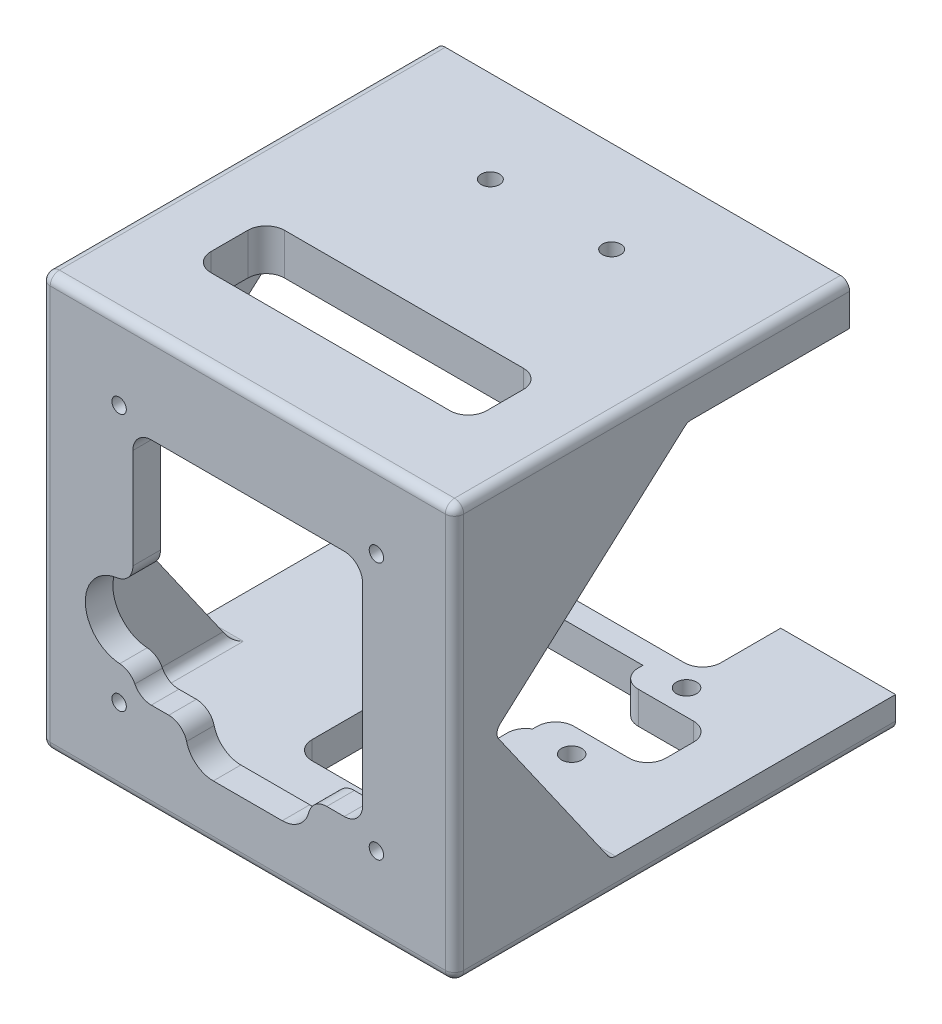
from build123d import *

# Parameters (mm, degrees)
BOSS_EXTRUDE1_START     = -5
BOSS_EXTRUDE1_OUTLINE_W = 45
BOSS_EXTRUDE1_OUTLINE_H = 45
BOSS_EXTRUDE1_OUTLINE_R = 0.7835
BOSS_EXTRUDE1_DEPTH     = 3
FILLET1_R               = 2
SKETCH2_W               = 45
SKETCH2_H               = 3.5
BOSS_EXTRUDE2_DEPTH     = 45
SKETCH3_R               = 1.1
CUT_EXTRUDE1_DEPTH      = 54
SKETCH4_W               = 20
SKETCH4_H               = 8.5
CUT_EXTRUDE2_DEPTH      = 54
FILLET2_R               = 2
SKETCH5_W               = 4.5
SKETCH5_H               = 7
SKETCH5_W_2             = 5.5
SKETCH5_W_3             = 10
SKETCH5_H_2             = 15
CUT_EXTRUDE3_DEPTH      = 54
FILLET3_R               = 2
FILLET4_R               = 2
SKETCH6_W               = 45
SKETCH6_H               = 4.5
BOSS_EXTRUDE3_DEPTH     = 60
FILLET5_R               = 1
FILLET6_R               = 1
BOSS_EXTRUDE4_DEPTH     = 3.5
FILLET7_R               = 1
SKETCH8_R               = 1
CUT_EXTRUDE4_DEPTH      = 7.5
FILLET8_R               = 1
SKETCH9_W               = 45
SKETCH9_H               = 20
CUT_EXTRUDE5_DEPTH      = 10
SKETCH11_W              = 30
SKETCH11_H              = 8
CUT_EXTRUDE6_DEPTH      = 4.5
FILLET12_R              = 2


with BuildPart() as part:
    # Boss-Extrude1: read off the stored shape, not the designer's step
    # Boss-Extrude1 outline → Boss-Extrude1 (new body)
    with BuildSketch(Plane.XY.offset(BOSS_EXTRUDE1_START)):
        with Locations((-16.999895153, 17.00005562)):
            Rectangle(BOSS_EXTRUDE1_OUTLINE_W, BOSS_EXTRUDE1_OUTLINE_H)
        with Locations((-30.999895153, 3.00005562)):
            Circle(BOSS_EXTRUDE1_OUTLINE_R, mode=Mode.SUBTRACT)
        with BuildLine():
            ThreePointArc((-29.499947577, 6.853115409), (-34.677423456, 10.675882804), (-29.499947577, 14.498650198))
            Line((-29.499947577, 14.498650198), (-29.499947577, 27.500003196))
            ThreePointArc((-29.499947577, 27.500003196), (-28.914161139, 28.914216759), (-27.499947577, 29.500003196))
            Line((-27.499947577, 29.500003196), (-6.499947577, 29.500003196))
            ThreePointArc((-6.499947577, 29.500003196), (-5.085734014, 28.914216759), (-4.499947577, 27.500003196))
            Line((-4.499947577, 27.500003196), (-4.499947577, 6.500052423))
            ThreePointArc((-4.499947577, 6.500052423), (-5.085734015, 5.08583886), (-6.499947577, 4.500052423))
            Line((-6.499947577, 4.500052423), (-10.35058429, 4.500052423))
            ThreePointArc((-10.35058429, 4.500052423), (-10.872063447, 1.901121953), (-13.250085888, 0.730058603))
            Line((-13.250085888, 0.730058603), (-20.750085888, 0.730058603))
            ThreePointArc((-20.750085888, 0.730058603), (-23.128108329, 1.901121953), (-23.649587486, 4.500052423))
            Line((-23.649587486, 4.500052423), (-27.499947577, 4.500052423))
            ThreePointArc((-27.499947577, 4.500052423), (-28.914161139, 5.085838861), (-29.499947577, 6.500052423))
            Line((-29.499947577, 6.500052423), (-29.499947577, 6.853115409))
        make_face(mode=Mode.SUBTRACT)
        with Locations((-2.999887524, 3.00005562)):
            Circle(BOSS_EXTRUDE1_OUTLINE_R, mode=Mode.SUBTRACT)
        with Locations((-30.999895153, 31.00005562)):
            Circle(BOSS_EXTRUDE1_OUTLINE_R, mode=Mode.SUBTRACT)
        with Locations((-2.999887524, 31.00005562)):
            Circle(BOSS_EXTRUDE1_OUTLINE_R, mode=Mode.SUBTRACT)
    extrude(amount=BOSS_EXTRUDE1_DEPTH)

    # Fillet1
    fillet1_edges = [part.edges().sort_by_distance(p)[0] for p in [
        (-10.35058429, 4.500052423, -3.5),
        (-29.499947577, 14.498650198, -3.5),
        (-29.499947577, 6.853115409, -3.5),
        (-23.649587486, 4.500052423, -3.5),
    ]]
    fillet(fillet1_edges, radius=FILLET1_R)

    # Sketch2 → Boss-Extrude2 (add)
    with BuildSketch(Plane(origin=(0, 0, -5), x_dir=(-1, 0, 0), z_dir=(0, 0, -1))):
        with Locations((16.999895153, -3.74994438)):
            Rectangle(SKETCH2_W, SKETCH2_H)
    extrude(amount=BOSS_EXTRUDE2_DEPTH)

    # Sketch3 → Cut-Extrude1 (cut)
    with BuildSketch(Plane(origin=(0, -1.99994438, 0), x_dir=(1, 0, 0), z_dir=(0, 1, 0))):
        with BuildLine():
            Line((-27.499895153, 27.85), (-27.499895153, 26.75))
            Line((-27.499895153, 26.75), (-26.399895153, 26.75))
            ThreePointArc((-26.399895153, 26.75), (-26.722077694, 27.527817459), (-27.499895153, 27.85))
        make_face()
        with BuildLine():
            Line((-26.399895153, 26.75), (-27.499895153, 26.75))
            Line((-27.499895153, 26.75), (-27.499895153, 27.85))
            ThreePointArc((-27.499895153, 27.85), (-28.277712612, 25.972182541), (-26.399895153, 26.75))
        make_face()
        with BuildLine():
            ThreePointArc((-7.599895153, 39.25), (-7.277712612, 38.472182541), (-6.499895153, 38.15))
            Line((-6.499895153, 38.15), (-6.499895153, 39.25))
            Line((-6.499895153, 39.25), (-7.599895153, 39.25))
        make_face()
        with BuildLine():
            Line((-6.499895153, 39.25), (-6.499895153, 38.15))
            ThreePointArc((-6.499895153, 38.15), (-5.722077694, 38.472182541), (-5.399895153, 39.25))
            ThreePointArc((-5.399895153, 39.25), (-6.499895153, 40.35), (-7.599895153, 39.25))
            Line((-7.599895153, 39.25), (-6.499895153, 39.25))
        make_face()
        with BuildLine():
            ThreePointArc((-26.399895153, 39.25), (-28.277712612, 40.027817459), (-27.499895153, 38.15))
            Line((-27.499895153, 38.15), (-27.499895153, 39.25))
            Line((-27.499895153, 39.25), (-26.399895153, 39.25))
        make_face()
        with BuildLine():
            Line((-27.499895153, 39.25), (-27.499895153, 38.15))
            ThreePointArc((-27.499895153, 38.15), (-26.722077694, 38.472182541), (-26.399895153, 39.25))
            Line((-26.399895153, 39.25), (-27.499895153, 39.25))
        make_face()
        with Locations(Location((-6.499895153, 26.75, 0), (0, 0, 270))):
            Circle(SKETCH3_R)
    extrude(amount=-CUT_EXTRUDE1_DEPTH, mode=Mode.SUBTRACT)

    # Sketch4 → Cut-Extrude2 (cut)
    with BuildSketch(Plane(origin=(0, -1.99994438, 0), x_dir=(1, 0, 0), z_dir=(0, 1, 0))):
        with Locations((-16.999895153, 45.75)):
            Rectangle(SKETCH4_W, SKETCH4_H)
    extrude(amount=-CUT_EXTRUDE2_DEPTH, mode=Mode.SUBTRACT)

    # Fillet2
    fillet2_edges = [part.edges().sort_by_distance(p)[0] for p in [
        (-6.999895153, -3.74994438, -41.5),
        (-26.999895153, -3.74994438, -41.5),
    ]]
    fillet(fillet2_edges, radius=FILLET2_R)

    # Sketch5 → Cut-Extrude3 (cut)
    with BuildSketch(Plane.XZ.offset(5.49994438)):
        Polygon((-22.999895153, -36.5), (-22.999895153, -36.571428571), (-16.999895153, -33), (-22.999895153, -29.428571429), (-22.999895153, -29.5), align=None)
        Polygon((-22.999895153, -29.428571429), (-16.999895153, -33), (-10.999895153, -29.428571429), (-10.999895153, -27), (-11.999895153, -27), (-21.999895153, -27), (-22.999895153, -27), align=None)
        Polygon((-10.999895153, -29.428571429), (-16.999895153, -33), (-10.999895153, -36.571428571), (-10.999895153, -36.5), (-10.999895153, -29.5), align=None)
        Polygon((-16.999895153, -33), (-22.999895153, -36.571428571), (-22.999895153, -39), (-10.999895153, -39), (-10.999895153, -36.571428571), align=None)
        with Locations((-25.249895153, -33)):
            Rectangle(SKETCH5_W, SKETCH5_H)
        with Locations((-30.249895153, -33)):
            Rectangle(SKETCH5_W_2, SKETCH5_H)
        with Locations((-16.999895153, -19.5)):
            Rectangle(SKETCH5_W_3, SKETCH5_H_2)
        with Locations((-3.749895153, -33)):
            Rectangle(SKETCH5_W_2, SKETCH5_H)
        with Locations((-8.749895153, -33)):
            Rectangle(SKETCH5_W, SKETCH5_H)
    extrude(amount=-CUT_EXTRUDE3_DEPTH, mode=Mode.SUBTRACT)

    # Fillet3
    # the kernel refuses this fillet: 2 mm, written as the material it adds along each edge
    with BuildSketch(Plane(origin=(-32.999895153, -5.49994438, -36.5), x_dir=(0, 0, 1), z_dir=(0, 1, 0)), Plane(origin=(-32.999895153, -5.49994438, -29.5), x_dir=(1, 0, 0), z_dir=(0, 1, 0)), Plane(origin=(-0.999895153, -5.49994438, -36.5), x_dir=(-1, 0, 0), z_dir=(0, 1, 0)), Plane(origin=(-0.999895153, -5.49994438, -29.5), x_dir=(0, 0, -1), z_dir=(0, 1, 0)), Plane(origin=(-21.999895153, -5.49994438, -12), x_dir=(1, 0, 0), z_dir=(0, 1, 0)), Plane(origin=(-11.999895153, -5.49994438, -12), x_dir=(0, 0, -1), z_dir=(0, 1, 0))) as fillet3_piece_1:
        with BuildLine():
            CenterArc((FILLET3_R, FILLET3_R), FILLET3_R, 180, 90)
            Line((0, FILLET3_R), (0, 0))
            Line((0, 0), (FILLET3_R, 0))
        make_face()
    extrude(amount=3.5)
    # the kernel refuses this fillet: 2 mm, written as the material it takes off along each edge
    with BuildSketch(Plane(origin=(-22.999895153, -10.49994438, -36.5), x_dir=(-1, 0, 0), z_dir=(0, 1, 0)), Plane(origin=(-10.999895153, -10.49994438, -36.5), x_dir=(0, 0, -1), z_dir=(0, 1, 0)), Plane(origin=(-10.999895153, -10.49994438, -29.5), x_dir=(1, 0, 0), z_dir=(0, 1, 0))) as fillet3_2_piece_1:
        with BuildLine():
            CenterArc((FILLET3_R, -FILLET3_R), FILLET3_R, 90, 90)
            Line((0, -FILLET3_R), (0, 0))
            Line((0, 0), (FILLET3_R, 0))
        make_face()
    extrude(amount=13.5, mode=Mode.SUBTRACT)
    with BuildSketch(Plane(origin=(-11.999895153, -9.830071399, -27), x_dir=(1, 0, 0), z_dir=(0, 1, 0))) as fillet3_2_piece_2:
        with BuildLine():
            CenterArc((2, -1.732050808), FILLET3_R, 120, 60)
            Line((0, -1.732050808), (0, 0))
            Line((0, 0), (1, 0))
        make_face()
    extrude(amount=12.160254038, mode=Mode.SUBTRACT)
    with BuildSketch(Plane(origin=(-22.999895153, -10.49994438, -29.5), x_dir=(-1, 0, 0), z_dir=(0, 1, 0))) as fillet3_2_piece_3:
        with BuildLine():
            CenterArc((FILLET3_R, FILLET3_R), FILLET3_R, 180, 90)
            Line((0, FILLET3_R), (0, 0))
            Line((0, 0), (FILLET3_R, 0))
        make_face()
    extrude(amount=13.5, mode=Mode.SUBTRACT)
    with BuildSketch(Plane(origin=(-21.999895153, -9.830071399, -27), x_dir=(0, 0, 1), z_dir=(0, 1, 0))) as fillet3_2_piece_4:
        with BuildLine():
            CenterArc((1.732050808, -2), FILLET3_R, 90, 60)
            Line((0, -1), (0, 0))
            Line((0, 0), (1.732050808, 0))
        make_face()
    extrude(amount=12.160254038, mode=Mode.SUBTRACT)

    # Fillet4
    fillet4_edges = [part.edges().sort_by_distance(p)[0] for p in [
        (-16.999895153, -1.99994438, -5),
    ]]
    fillet(fillet4_edges, radius=FILLET4_R)

    # Sketch6 → Boss-Extrude3 (add)
    with BuildSketch(Plane(origin=(0, 0, -5), x_dir=(-1, 0, 0), z_dir=(0, 0, -1))):
        with Locations((16.999895153, 37.25005562)):
            Rectangle(SKETCH6_W, SKETCH6_H)
    extrude(amount=BOSS_EXTRUDE3_DEPTH)

    # Fillet5
    fillet5_edges = [part.edges().sort_by_distance(p)[0] for p in [
        (-16.999895153, -5.49994438, -2),
    ]]
    fillet(fillet5_edges, radius=FILLET5_R)

    # Fillet6
    fillet6_edges = [part.edges().sort_by_distance(p)[0] for p in [
        (-16.999895153, 39.50005562, -2),
    ]]
    fillet(fillet6_edges, radius=FILLET6_R)

    # Sketch7 → Boss-Extrude4 (add)
    with BuildSketch(Plane(origin=(5.500104847, 0, 0), x_dir=(0, 0, -1), z_dir=(1, 0, 0))):
        Polygon((5, 18.00005562), (6.291434259, 16.155149536), (27.360679775, 35.00005562), (5, 35.00005562), align=None)
        Polygon((5, 15.00005562), (6.291434259, 16.155149536), (5, 18.00005562), align=None)
        with BuildLine():
            Line((7, -1.99994438), (19, -1.99994438))
            Line((19, -1.99994438), (6.291434259, 16.155149536))
            Line((6.291434259, 16.155149536), (5, 15.00005562))
            Line((5, 15.00005562), (5, 5.562e-05))
            ThreePointArc((5, 5.562e-05), (5.585786438, -1.414157943), (7, -1.99994438))
        make_face()
    boss_extrude4 = extrude(amount=-BOSS_EXTRUDE4_DEPTH)

    # Mirror1: Boss-Extrude4 across plane
    add(boss_extrude4.mirror(Plane(origin=(-16.999895153, 0, 0), x_dir=(0, 0, 1), z_dir=(1, 0, 0))))

    # Fillet7
    fillet7_edges = [part.edges().sort_by_distance(p)[0] for p in [
        (-16.999895153, 35.00005562, -5),
        (3.750104847, 35.00005562, -27.360679775),
        (3.750104847, 16.155149536, -6.291434259),
        (3.750104847, -1.99994438, -19),
        (2.000104847, 17.50005562, -5),
        (2.000104847, -1.99994438, -13),
        (2.000104847, -1.414157943, -5.585786438),
        (-35.999895153, 17.50005562, -5),
        (-35.999895153, -1.414157943, -5.585786438),
        (-35.999895153, -1.99994438, -13),
        (-37.749895153, -1.99994438, -19),
        (-37.749895153, 16.155149536, -6.291434259),
        (-35.999895153, 35.00005562, -16.180339887),
        (-37.749895153, 35.00005562, -27.360679775),
    ]]
    fillet(fillet7_edges, radius=FILLET7_R)

    # Sketch8 → Cut-Extrude4 (cut)
    with BuildSketch(Plane(origin=(0, 39.50005562, 0), x_dir=(1, 0, 0), z_dir=(0, 1, 0))):
        with Locations(Location((-23.599895153, 35, 0), (0, 0, 270))):
            Circle(SKETCH8_R)
        with Locations(Location((-10.399895153, 35, 0), (0, 0, 270))):
            Circle(SKETCH8_R)
    extrude(amount=-CUT_EXTRUDE4_DEPTH, mode=Mode.SUBTRACT)

    # Fillet8
    fillet8_edges = [part.edges().sort_by_distance(p)[0] for p in [
        (5.500104847, 17.00005562, -2),
        (-39.499895153, 17.00005562, -2),
        (5.500104847, -5.207051161, -2.292893219),
        (-39.499895153, -5.207051161, -2.292893219),
        (5.500104847, 39.207162401, -2.292893219),
        (-39.499895153, 39.207162401, -2.292893219),
        (-39.499895153, -5.49994438, -27.5),
        (-39.499895153, 39.50005562, -35),
        (5.500104847, 39.50005562, -35),
        (5.500104847, -5.49994438, -26.5),
    ]]
    fillet(fillet8_edges, radius=FILLET8_R)

    # Sketch9 → Cut-Extrude5 (cut)
    with BuildSketch(Plane(origin=(0, 39.50005562, 0), x_dir=(1, 0, 0), z_dir=(0, 1, 0))):
        with Locations((-16.999895153, 55)):
            Rectangle(SKETCH9_W, SKETCH9_H)
    extrude(amount=-CUT_EXTRUDE5_DEPTH, mode=Mode.SUBTRACT)

    # Sketch11 → Cut-Extrude6 (cut)
    with BuildSketch(Plane(origin=(0, 39.50005562, 0), x_dir=(1, 0, 0), z_dir=(0, 1, 0))):
        with Locations((-16.999895153, 15)):
            Rectangle(SKETCH11_W, SKETCH11_H)
    extrude(amount=-CUT_EXTRUDE6_DEPTH, mode=Mode.SUBTRACT)

    # Fillet12
    fillet12_edges = [part.edges().sort_by_distance(p)[0] for p in [
        (-1.999895153, 37.25005562, -19),
        (-1.999895153, 37.25005562, -11),
        (-31.999895153, 37.25005562, -11),
        (-31.999895153, 37.25005562, -19),
    ]]
    fillet(fillet12_edges, radius=FILLET12_R)


solid = part.part
